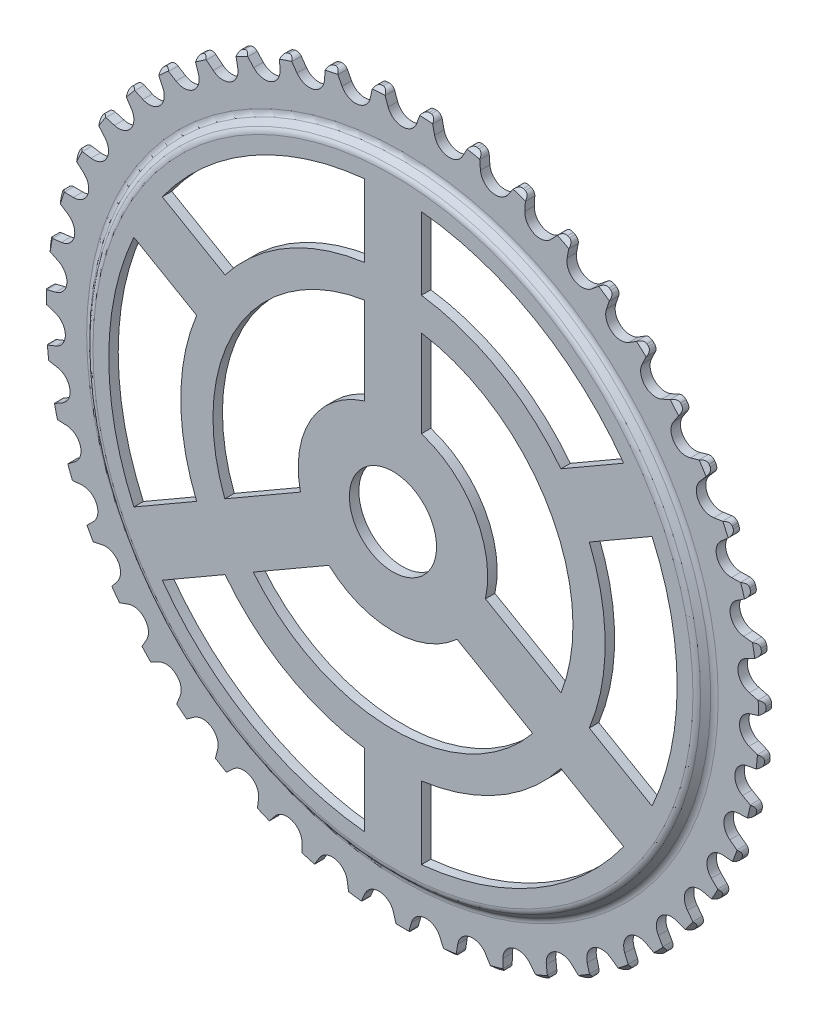
from build123d import *

# Parameters (mm, degrees)
CORTAR_EXTRUIR1_DEPTH = 135.443296597
MATRIZC1_COUNT        = 3
CORTAR_EXTRUIR2_DEPTH = 135.443296597
MATRIZC2_COUNT        = 6
CHAFL_N1_SIZE         = 1
CORTAR_EXTRUIR3_DEPTH = 135.373546504
MATRIZC3_COUNT        = 47
REDONDEO1_R           = 1.5
REDONDEO2_R           = 2


with BuildPart() as part:
    # Croquis1 → Revolución1 (revolve)
    with BuildSketch(Plane(origin=(0, 0, 0), x_dir=(0, 0, -1), z_dir=(1, 0, 0))):
        Polygon((0, 11.5), (0, 80), (2.5, 82.5), (2.5, 95), (5, 95), (5, 81.464466094), (2.5, 78.964466094), (2.5, 11.5), align=None)
    revolve(axis=Axis((0, 0, 0), (0, 0, -1)))

    # Croquis2 → Cortar-Extruir1 (cut, through all)
    with BuildSketch(Plane.XY):
        with BuildLine():
            Line((7.5, 23.848480035), (7.5, 46.904157598))
            ThreePointArc((7.5, 46.904157598), (41.13620668, 23.75), (44.370192023, -16.956888271))
            Line((44.370192023, -16.956888271), (24.403389552, -5.429049489))
            ThreePointArc((24.403389552, -5.429049489), (21.650635095, 12.5), (7.5, 23.848480035))
        make_face()
    cortar_extruir1 = extrude(amount=-CORTAR_EXTRUIR1_DEPTH, mode=Mode.SUBTRACT)

    # MatrizC1: Cortar-Extruir1 ×3 about axis
    matrizc1_axis = Axis((0, 0, 0), (0, 0, 1))
    for i in range(1, MATRIZC1_COUNT):
        add(cortar_extruir1.rotate(matrizc1_axis, i * 360 / MATRIZC1_COUNT), mode=Mode.SUBTRACT)

    # Croquis3 → Cortar-Extruir2 (cut, through all)
    with BuildSketch(Plane.XY):
        with BuildLine():
            Line((7.5, 74.624057783), (7.5, 55.495495313))
            ThreePointArc((7.5, 55.495495313), (28, 48.497422612), (44.310508736, 34.242938185))
            Line((44.310508736, 34.242938185), (60.876329774, 43.80721942))
            ThreePointArc((60.876329774, 43.80721942), (37.5, 64.951905284), (7.5, 74.624057783))
        make_face()
    cortar_extruir2 = extrude(amount=-CORTAR_EXTRUIR2_DEPTH, mode=Mode.SUBTRACT)

    # MatrizC2: Cortar-Extruir2 ×6 about axis
    matrizc2_axis = Axis((0, 0, -2.5), (0, 0, 1))
    for i in range(1, MATRIZC2_COUNT):
        add(cortar_extruir2.rotate(matrizc2_axis, i * 360 / MATRIZC2_COUNT), mode=Mode.SUBTRACT)

    # Chaflán1
    chafl_n1_edges = [part.edges().sort_by_distance(p)[0] for p in [
        (0, -95, -2.5),
    ]]
    chamfer(chafl_n1_edges, length=CHAFL_N1_SIZE)

    # Croquis5 → Cortar-Extruir3 (cut, through all)
    with BuildSketch(Plane.XY.offset(-2.5)):
        with BuildLine():
            Line((3.758770483, 91.631919427), (8.806339018, 105.5))
            Line((8.806339018, 105.5), (-8.806339018, 105.5))
            Line((-8.806339018, 105.5), (-3.758770483, 91.631919427))
            ThreePointArc((-3.758770483, 91.631919427), (0, 89), (3.758770483, 91.631919427))
        make_face()
    cortar_extruir3 = extrude(amount=-CORTAR_EXTRUIR3_DEPTH, mode=Mode.SUBTRACT)

    # MatrizC3: Cortar-Extruir3 ×47 about axis
    matrizc3_axis = Axis((0, 0, 0), (0, 0, 1))
    for i in range(1, MATRIZC3_COUNT):
        add(cortar_extruir3.rotate(matrizc3_axis, i * 360 / MATRIZC3_COUNT), mode=Mode.SUBTRACT)

    # Redondeo1
    redondeo1_edges = [part.edges().sort_by_distance(p)[0] for p in [
        (4.937911156, 94.871581801, -4.25),
        (7.751291704, 94.683248132, -4.25),
        (-20.302172581, 92.805289658, -4.25),
        (-29.82709878, 90.196142813, -4.25),
        (-32.490760706, 89.271218591, -4.25),
        (-41.582935399, 85.415803477, -4.25),
        (-44.099550438, 84.144100513, -4.25),
        (-52.596723552, 79.111217103, -4.25),
        (-54.921382646, 77.515428969, -4.25),
        (-62.671921927, 71.394889187, -4.25),
        (-64.763141481, 69.503492758, -4.25),
        (-71.62873837, 62.404517781, -4.25),
        (-73.449200522, 60.251265072, -4.25),
        (-79.30733828, 52.300536278, -4.25),
        (-80.824556839, 49.923852133, -4.25),
        (-85.57069686, 41.263250465, -4.25),
        (-86.757597024, 38.705546871, -4.25),
        (-90.307044327, 29.48962097, -4.25),
        (-91.142445836, 26.796540208, -4.25),
        (-93.431860448, 17.189748491, -4.25),
        (-93.900855542, 14.409348649, -4.25),
        (-94.889382807, 4.583124542, -4.25),
        (-94.983602256, 1.765021923, -4.25),
        (-94.653601881, -8.105285372, -4.25),
        (-94.371364339, -10.910801661, -4.25),
        (-92.728725187, -20.649056277, -4.25),
        (-92.075067188, -23.391921731, -4.25),
        (-89.149102196, -32.824344284, -4.25),
        (-88.135688283, -35.455612404, -4.25),
        (-83.978611364, -44.413881089, -4.25),
        (-4.937911156, 94.871581801, -4.25),
        (-7.751291704, 94.683248132, -4.25),
        (-17.538996875, 93.366929845, -4.25),
        (-82.623525932, -46.886596833, -4.25),
        (-77.309520222, -55.210851134, -4.25),
        (-75.636944803, -57.480888831, -4.25),
        (-67.300620603, -67.049433006, -4.25),
        (-69.260838861, -65.022582233, -4.25),
        (-59.97619619, -73.673983811, -4.25),
        (-57.763315233, -75.421478461, -4.25),
        (-49.621276876, -81.010671403, -4.25),
        (-47.195222135, -82.447625846, -4.25),
        (-38.380864701, -86.901721644, -4.25),
        (-35.78492918, -88.002493394, -4.25),
        (-26.455545087, -91.242008604, -4.25),
        (-23.736053316, -91.986954363, -4.25),
        (-14.058125643, -93.954079759, -4.25),
        (-11.263607018, -94.329905952, -4.25),
        (-1.409838615, -94.989538135, -4.25),
        (1.409838615, -94.989538135, -4.25),
        (11.263607018, -94.329905952, -4.25),
        (14.058125643, -93.954079759, -4.25),
        (23.736053316, -91.986954363, -4.25),
        (26.455545087, -91.242008604, -4.25),
        (35.78492918, -88.002493394, -4.25),
        (38.380864701, -86.901721644, -4.25),
        (47.195222135, -82.447625846, -4.25),
        (49.621276876, -81.010671403, -4.25),
        (57.763315233, -75.421478461, -4.25),
        (59.97619619, -73.673983811, -4.25),
        (67.300620603, -67.049433006, -4.25),
        (69.260838861, -65.022582233, -4.25),
        (75.636944803, -57.480888831, -4.25),
        (77.309520222, -55.210851134, -4.25),
        (82.623525932, -46.886596833, -4.25),
        (83.978611364, -44.413881089, -4.25),
        (88.135688283, -35.455612404, -4.25),
        (89.149102196, -32.824344284, -4.25),
        (92.075067188, -23.391921731, -4.25),
        (92.728725187, -20.649056277, -4.25),
        (94.371364339, -10.910801661, -4.25),
        (94.653601881, -8.105285372, -4.25),
        (94.983602256, 1.765021923, -4.25),
        (94.889382807, 4.583124542, -4.25),
        (93.900855542, 14.409348649, -4.25),
        (93.431860448, 17.189748491, -4.25),
        (91.142445836, 26.796540208, -4.25),
        (90.307044327, 29.48962097, -4.25),
        (86.757597024, 38.705546871, -4.25),
        (85.57069686, 41.263250465, -4.25),
        (80.824556839, 49.923852133, -4.25),
        (79.30733828, 52.300536278, -4.25),
        (73.449200522, 60.251265072, -4.25),
        (71.62873837, 62.404517781, -4.25),
        (64.763141481, 69.503492758, -4.25),
        (62.671921927, 71.394889187, -4.25),
        (54.921382646, 77.515428969, -4.25),
        (52.596723552, 79.111217103, -4.25),
        (44.099550438, 84.144100513, -4.25),
        (41.582935399, 85.415803477, -4.25),
        (32.490760706, 89.271218591, -4.25),
        (29.82709878, 90.196142813, -4.25),
        (17.538996875, 93.366929845, -4.25),
        (20.302172581, 92.805289658, -4.25),
    ]]
    fillet(redondeo1_edges, radius=REDONDEO1_R)

    # Redondeo2
    redondeo2_edges = [part.edges().sort_by_distance(p)[0] for p in [
        (0, -80, 0),
        (0, -81.464466094, -5),
        (0, -82.5, -2.5),
        (0, -78.964466094, -2.5),
    ]]
    fillet(redondeo2_edges, radius=REDONDEO2_R)


solid = part.part
